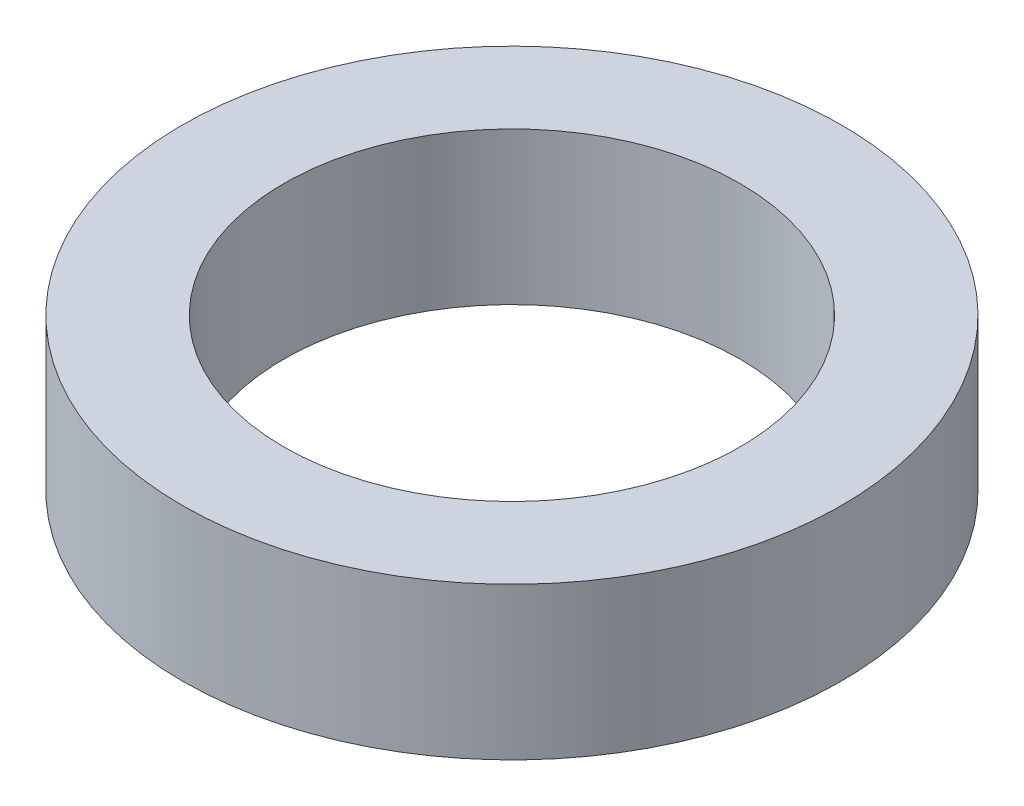
from build123d import *

# Parameters (mm, degrees)
ESQUISSE1_R        = 3.25
ESQUISSE1_R_2      = 2.25
BOSS_EXTRU_1_DEPTH = 1.5


with BuildPart() as part:
    # Esquisse1 → Boss.-Extru.1 (new body)
    with BuildSketch(Plane(origin=(0, 0, 0), x_dir=(1, 0, 0), z_dir=(0, 1, 0))):
        Circle(ESQUISSE1_R)
        Circle(ESQUISSE1_R_2, mode=Mode.SUBTRACT)
    extrude(amount=BOSS_EXTRU_1_DEPTH)


solid = part.part
